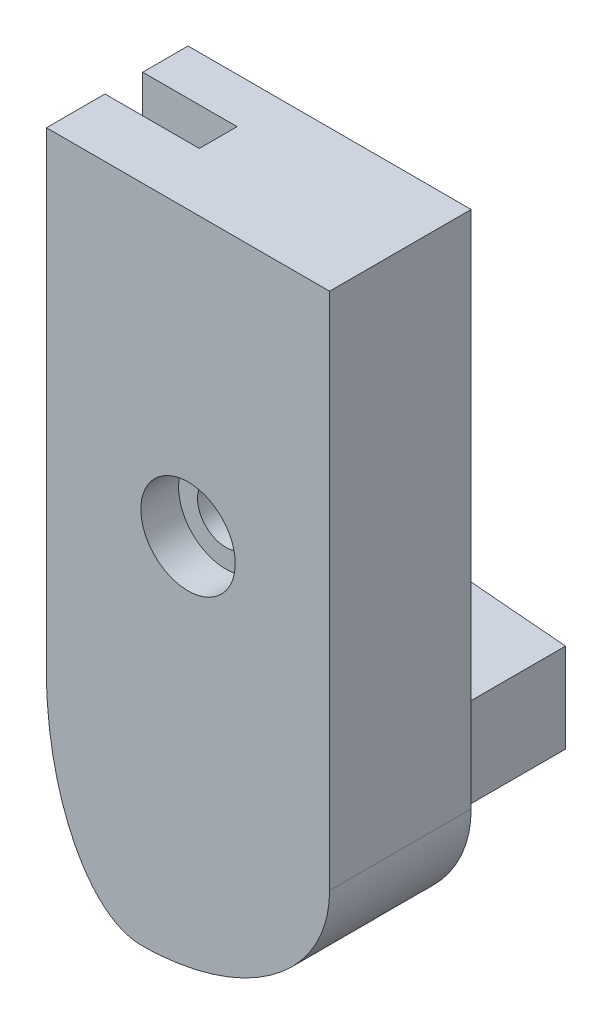
from build123d import *

# Parameters (mm, degrees)
SKETCH1_W           = 30
SKETCH1_H           = 60
BOSS_EXTRUDE1_DEPTH = 7.5
SKETCH4_W           = 4
SKETCH4_H           = 60
CUT_EXTRUDE1_DEPTH  = 10
CUT_EXTRUDE2_DEPTH  = 3
SKETCH6_W           = 30
SKETCH6_H           = 15
BOSS_EXTRUDE2_DEPTH = 10
FILLET1_SIZE        = 10
FILLET1_SIZE_2      = 20
BOSS_EXTRUDE3_DEPTH = 25
FILLET2_SIZE        = 20
FILLET2_SIZE_2      = 15
FILLET3_R           = 6
FILLET4_R           = 6


with BuildPart() as part:
    # Sketch1 → Boss-Extrude1 (new, symmetric)
    with BuildSketch(Plane.XY):
        Rectangle(SKETCH1_W, SKETCH1_H)
    extrude(amount=BOSS_EXTRUDE1_DEPTH, both=True)

    # Sketch3 → Cut-Revolve1 (revolve, cut)
    with BuildSketch(Plane(origin=(0, 0, 0), x_dir=(0, 0, -1), z_dir=(1, 0, 0)), mode=Mode.PRIVATE) as cut_revolve1_sk:
        Polygon((-7.5, -5), (-3.5, -5), (-3.5, -3), (3.5, -3), (3.5, -5), (7.5, -5), (7.5, 0), (-7.5, 0), align=None)
    revolve(cut_revolve1_sk.sketch.rotate(Axis((0, 0, 19.169416837), (0, 0, -1)), 270), axis=Axis((0, 0, 19.169416837), (0, 0, -1)), mode=Mode.SUBTRACT)

    # Sketch4 → Cut-Extrude1 (cut)
    with BuildSketch(Plane.ZY.offset(15)):
        with Locations((-0.695939916, 0)):
            Rectangle(SKETCH4_W, SKETCH4_H)
    extrude(amount=-CUT_EXTRUDE1_DEPTH, mode=Mode.SUBTRACT)

    # Sketch5 → Cut-Extrude2 (cut)
    with BuildSketch(Plane.XY.offset(-7.5)):
        Polygon((0, -5.5), (-15, -0.040446486), (-15, 1.364268174), (0, -4.09528534), align=None)
    extrude(amount=CUT_EXTRUDE2_DEPTH, mode=Mode.SUBTRACT)

    # Sketch6 → Boss-Extrude2 (add)
    with BuildSketch(Plane(origin=(0, -30, 0), x_dir=(1, 0, 0), z_dir=(0, 1, 0))):
        Rectangle(SKETCH6_W, SKETCH6_H)
    extrude(amount=-BOSS_EXTRUDE2_DEPTH)

    # Fillet1
    # an asymmetric fillet: 20, 10 mm, written as the material it takes off along each edge
    with BuildSketch(Plane(origin=(-15, -40, 57.5), x_dir=(1, 0, 0), z_dir=(0, 0, -1))) as fillet1_piece_1:
        with BuildLine():
            Bezier((FILLET1_SIZE, 0), (0, 0), (0, -FILLET1_SIZE_2), weights=[1, 0.707106781, 1])
            Line((0, -FILLET1_SIZE_2), (0, 0))
            Line((0, 0), (FILLET1_SIZE, 0))
        make_face()
    extrude(amount=115, mode=Mode.SUBTRACT)

    # Sketch7<5> → Boss-Extrude3 (add)
    with BuildSketch(Plane(origin=(0, 0, -7.5), x_dir=(-1, 0, 0), z_dir=(0, 0, -1))):
        with BuildLine():
            Line((0, -30.068567995), (13.97008046, -28.844444564))
            add(Edge.make_bspline(
                [(5, -40), (6.475610406, -40), (7.888971767, -39.147202629), (9.083741797, -38.42629942), (10.154249723, -37.138694208), (11.86770272, -35.0777557), (13.053604417, -31.855708482), (13.581598782, -30.421169024), (13.97008046, -28.844444564)],
                knots=[0, 0, 0, 0.125, 0.125, 0.25, 0.25, 0.5, 0.5, 0.633954119, 0.633954119, 0.633954119], degree=2))
            Line((5, -40), (0, -40))
            Line((0, -40), (0, -30.068567995))
        make_face()
    extrude(amount=BOSS_EXTRUDE3_DEPTH)

    # Fillet2
    # an asymmetric fillet: 20, 15 mm, written as the material it takes off along each edge
    with BuildSketch(Plane(origin=(15, -40, -57.5), x_dir=(-1, 0, 0), z_dir=(0, 0, 1))) as fillet2_piece_1:
        with BuildLine():
            Bezier((FILLET2_SIZE, 0), (0, 0), (0, -FILLET2_SIZE_2), weights=[1, 0.707106781, 1])
            Line((0, -FILLET2_SIZE_2), (0, 0))
            Line((0, 0), (FILLET2_SIZE, 0))
        make_face()
    extrude(amount=115, mode=Mode.SUBTRACT)

    # Fillet3
    fillet3_edges = [part.edges().sort_by_distance(p)[0] for p in [
        (0, -34.796127772, -7.5),
    ]]
    fillet(fillet3_edges, radius=FILLET3_R)

    # Fillet4
    fillet4_edges = [part.edges().sort_by_distance(p)[0] for p in [
        (-3.984516256, -29.719426147, -7.5),
    ]]
    fillet(fillet4_edges, radius=FILLET4_R)


solid = part.part
